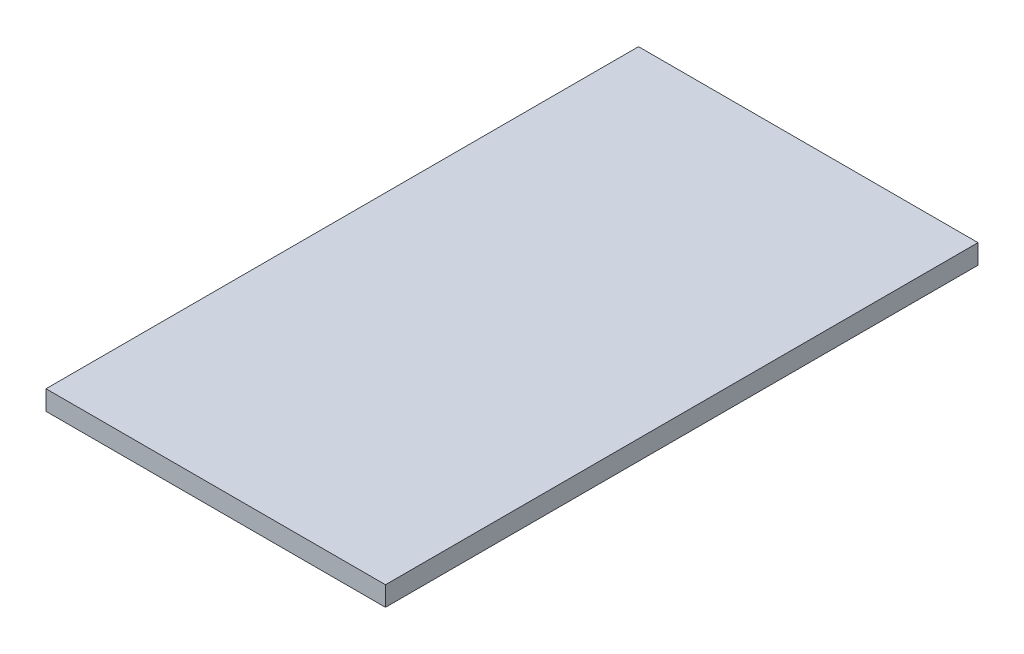
from build123d import *

# Parameters (mm, degrees)
SKETCH2_W           = 55
SKETCH2_H           = 96
BOSS_EXTRUDE1_DEPTH = 3.175


with BuildPart() as part:
    # Sketch2 → Boss-Extrude1 (new body)
    with BuildSketch(Plane(origin=(0, 0, 0), x_dir=(1, 0, 0), z_dir=(0, 1, 0))):
        with Locations((27.5, 48)):
            Rectangle(SKETCH2_W, SKETCH2_H)
    extrude(amount=BOSS_EXTRUDE1_DEPTH)


solid = part.part
